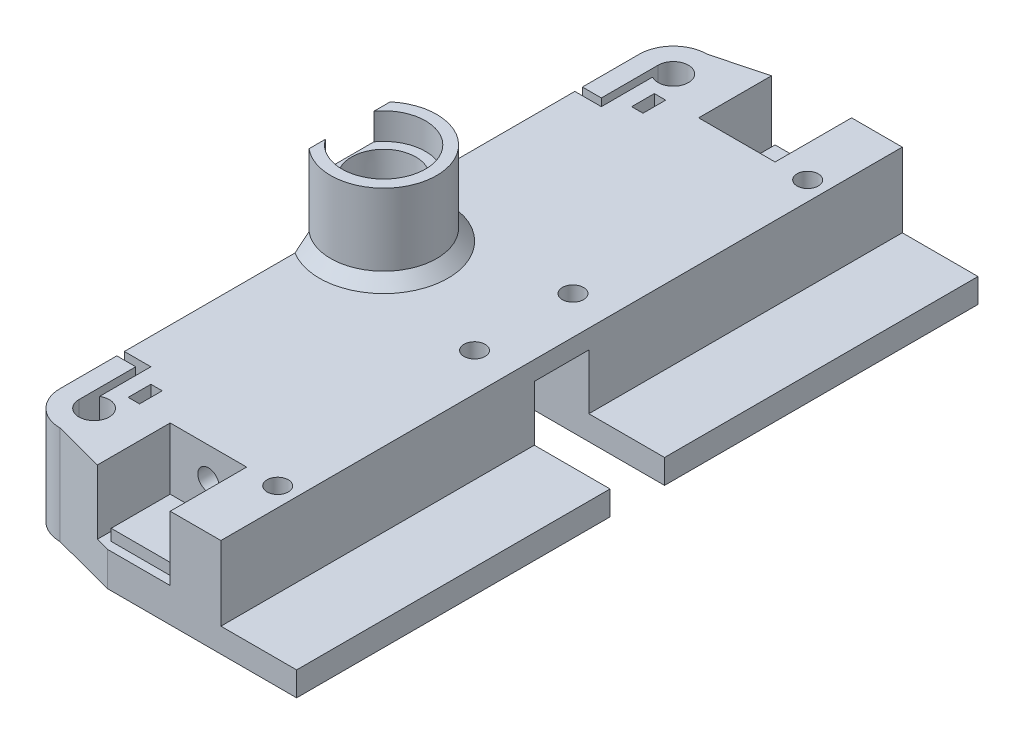
from build123d import *

# Parameters (mm, degrees)
DODANIE_WYCI_GNI_CIE1_DEPTH = 180
SZKIC2_R                    = 4
DODANIE_WYCI_GNI_CIE2_DEPTH = 26
WYTNIJ_WYCI_GNI_CIE1_DEPTH  = 26
SZKIC4_R                    = 1.75
WYTNIJ_WYCI_GNI_CIE2_DEPTH  = 11
WYTNIJ_WYCI_GNI_CIE3_START  = -11
WYTNIJ_WYCI_GNI_CIE3_DEPTH  = 3
DODANIE_WYCI_GNI_CIE3_START = -2
DODANIE_WYCI_GNI_CIE3_DEPTH = 2
WYTNIJ_WYCI_GNI_CIE5_DEPTH  = 21
SZKIC8_W                    = 13
SZKIC8_H                    = 9
SZKIC8_R                    = 2
WYTNIJ_WYCI_GNI_CIE6_DEPTH  = 4
DODANIE_WYCI_GNI_CIE4_START = 22
SZKIC9_R                    = 14
SZKIC9_R_2                  = 4
DODANIE_WYCI_GNI_CIE4_DEPTH = 22
SZKIC10_R                   = 11.05
SZKIC10_R_2                 = 4
WYTNIJ_WYCI_GNI_CIE7_DEPTH  = 7
SZKIC11_R                   = 8
SZKIC11_R_2                 = 4
WYTNIJ_WYCI_GNI_CIE8_DEPTH  = 15
SFAZOWANIE1_SIZE            = 0.5
SFAZOWANIE1_SIZE2           = 12
WYTNIJ_WYCI_GNI_CIE9_START  = 22
WYTNIJ_WYCI_GNI_CIE9_DEPTH  = 22
WYTNIJ_WYCI_GNI_CIE10_START = -3
SZKIC13_R                   = 4
WYTNIJ_WYCI_GNI_CIE10_DEPTH = 3
SZKIC14_R                   = 2
WYTNIJ_WYCI_GNI_CIE11_DEPTH = 8
SZKIC15_R                   = 2.8
WYTNIJ_WYCI_GNI_CIE12_DEPTH = 10
SFAZOWANIE2_SIZE            = 3
SZKIC16_W                   = 20.2
SZKIC16_H                   = 20.2
WYTNIJ_WYCI_GNI_CIE13_DEPTH = 17
SZKIC17_W                   = 15.6
SZKIC17_H                   = 15.6
DODANIE_WYCI_GNI_CIE5_DEPTH = 3
SZKIC18_R                   = 2.8
WYTNIJ_WYCI_GNI_CIE14_DEPTH = 10
SZKIC19_W                   = 20
SZKIC19_H                   = 82.8
DODANIE_WYCI_GNI_CIE6_DEPTH = 0.4


with BuildPart() as part:
    # Szkic1 → Dodanie-wyciągnięcie1 (new body)
    with BuildSketch(Plane.XY):
        Polygon((10, -16), (10, -10), (-10, -10), (-10, 10), (-40, 10), (-40, -16), align=None)
    extrude(amount=DODANIE_WYCI_GNI_CIE1_DEPTH)

    # Szkic2 → Dodanie-wyciągnięcie2 (add)
    with BuildSketch(Plane(origin=(0, 10, 0), x_dir=(1, 0, 0), z_dir=(0, 1, 0))):
        with BuildLine():
            Line((-40, -180), (-40, 0))
            Line((-40, 0), (-57, -4.5))
            ThreePointArc((-57, -4.5), (-63.363961031, -7.136038969), (-66, -13.5))
            Line((-66, -13.5), (-66, -166.5))
            ThreePointArc((-66, -166.5), (-63.363961031, -172.863961031), (-57, -175.5))
            Line((-57, -175.5), (-40, -180))
        make_face()
        with Locations((-57, -90)):
            Circle(SZKIC2_R, mode=Mode.SUBTRACT)
        with Locations((-57, -166.5)):
            Circle(SZKIC2_R, mode=Mode.SUBTRACT)
        with Locations((-57, -13.5)):
            Circle(SZKIC2_R, mode=Mode.SUBTRACT)
    extrude(amount=-DODANIE_WYCI_GNI_CIE2_DEPTH)

    # Szkic3 → Wytnij-wyciągnięcie1 (cut)
    with BuildSketch(Plane(origin=(0, 10, 0), x_dir=(1, 0, 0), z_dir=(0, 1, 0))):
        with BuildLine():
            ThreePointArc((-59, -16.964101615), (-60.464101615, -15.5), (-61, -13.5))
            Line((-61, -13.5), (-61, -28.5))
            Line((-61, -28.5), (-66, -28.5))
            Line((-66, -28.5), (-66, -30.5))
            Line((-66, -30.5), (-59, -30.5))
            Line((-59, -30.5), (-59, -16.964101615))
        make_face()
    wytnij_wyci_gni_cie1 = extrude(amount=-WYTNIJ_WYCI_GNI_CIE1_DEPTH, mode=Mode.SUBTRACT)

    # Szkic4 → Wytnij-wyciągnięcie2 (cut)
    with BuildSketch(Plane.ZY.offset(66)):
        with Locations((23.5, 3)):
            Circle(SZKIC4_R)
        with Locations((23.5, -9)):
            Circle(SZKIC4_R)
    wytnij_wyci_gni_cie2 = extrude(amount=-WYTNIJ_WYCI_GNI_CIE2_DEPTH, mode=Mode.SUBTRACT)

    # Szkic5 → Wytnij-wyciągnięcie3 (cut)
    with BuildSketch(Plane.ZY.offset(66).offset(WYTNIJ_WYCI_GNI_CIE3_START)):
        Polygon((20.5, 10), (20.5, 1.267949192), (23.5, -0.464101615), (26.5, 1.267949192), (26.5, 10), align=None)
        Polygon((26.5, -7.267949192), (23.5, -5.535898385), (20.5, -7.267949192), (20.5, -16), (26.5, -16), align=None)
    wytnij_wyci_gni_cie3 = extrude(amount=-WYTNIJ_WYCI_GNI_CIE3_DEPTH, mode=Mode.SUBTRACT)

    # Szkic6 → Dodanie-wyciągnięcie3 (add)
    with BuildSketch(Plane.XZ.offset(16).offset(DODANIE_WYCI_GNI_CIE3_START)):
        with BuildLine():
            Line((-57, 17.5), (-57, 9.5))
            ThreePointArc((-57, 9.5), (-53, 13.5), (-57, 17.5))
        make_face()
    dodanie_wyci_gni_cie3 = extrude(amount=DODANIE_WYCI_GNI_CIE3_DEPTH)

    # Lustro1: Wytnij-wyciągnięcie1, Wytnij-wyciągnięcie2, Wytnij-wyciągnięcie3, Dodanie-wyciągnięcie3 across plane
    add(wytnij_wyci_gni_cie1.mirror(Plane.XY.offset(90)), mode=Mode.SUBTRACT)
    add(wytnij_wyci_gni_cie2.mirror(Plane.XY.offset(90)), mode=Mode.SUBTRACT)
    add(wytnij_wyci_gni_cie3.mirror(Plane.XY.offset(90)), mode=Mode.SUBTRACT)
    add(dodanie_wyci_gni_cie3.mirror(Plane.XY.offset(90)))

    # Szkic7 → Wytnij-wyciągnięcie5 (cut)
    with BuildSketch(Plane.XZ.offset(16)):
        with BuildLine():
            ThreePointArc((-60, 97.2), (-62.121320344, 96.321320344), (-63, 94.2))
            Line((-63, 94.2), (-63, 85.8))
            ThreePointArc((-63, 85.8), (-62.121320344, 83.678679656), (-60, 82.8))
            Line((-60, 82.8), (-55.2, 82.8))
            ThreePointArc((-55.2, 82.8), (-51.7, 79.3), (-48.2, 82.8))
            Line((-48.2, 82.8), (11.571529958, 82.8))
            Line((11.571529958, 82.8), (11.571529958, 97.2))
            Line((11.571529958, 97.2), (-48.2, 97.2))
            ThreePointArc((-48.2, 97.2), (-51.7, 100.7), (-55.2, 97.2))
            Line((-55.2, 97.2), (-60, 97.2))
        make_face()
    extrude(amount=-WYTNIJ_WYCI_GNI_CIE5_DEPTH, mode=Mode.SUBTRACT)

    # Szkic8 → Wytnij-wyciągnięcie6 (cut)
    with BuildSketch(Plane.XZ.offset(-5)):
        with Locations((-41.7, 90)):
            Rectangle(SZKIC8_W, SZKIC8_H)
        with Locations((-51.7, 97.2)):
            Circle(SZKIC8_R)
        with Locations((-51.7, 82.8)):
            Circle(SZKIC8_R)
    extrude(amount=-WYTNIJ_WYCI_GNI_CIE6_DEPTH, mode=Mode.SUBTRACT)

    # Szkic9 → Dodanie-wyciągnięcie4 (add)
    with BuildSketch(Plane(origin=(0, 10, 0), x_dir=(1, 0, 0), z_dir=(0, 1, 0)).offset(DODANIE_WYCI_GNI_CIE4_START)):
        with Locations((-57, -90)):
            Circle(SZKIC9_R)
        with Locations((-57, -90)):
            Circle(SZKIC9_R_2, mode=Mode.SUBTRACT)
    extrude(amount=-DODANIE_WYCI_GNI_CIE4_DEPTH)

    # Szkic10 → Wytnij-wyciągnięcie7 (cut)
    with BuildSketch(Plane(origin=(0, 32, 0), x_dir=(1, 0, 0), z_dir=(0, 1, 0))):
        with Locations((-57, -90)):
            Circle(SZKIC10_R)
        with Locations((-57, -90)):
            Circle(SZKIC10_R_2, mode=Mode.SUBTRACT)
    extrude(amount=-WYTNIJ_WYCI_GNI_CIE7_DEPTH, mode=Mode.SUBTRACT)

    # Szkic11 → Wytnij-wyciągnięcie8 (cut)
    with BuildSketch(Plane(origin=(0, 25, 0), x_dir=(1, 0, 0), z_dir=(0, 1, 0))):
        with Locations((-57, -90)):
            Circle(SZKIC11_R)
        with Locations((-57, -90)):
            Circle(SZKIC11_R_2, mode=Mode.SUBTRACT)
    extrude(amount=-WYTNIJ_WYCI_GNI_CIE8_DEPTH, mode=Mode.SUBTRACT)

    # Sfazowanie1
    sfazowanie1_edges = [part.edges().sort_by_distance(p)[0] for p in [
        (-65, 25, 90),
    ]]
    sfazowanie1_side = [part.faces().sort_by_distance(p)[0] for p in [
        (-67.737458803, 25, 90),
    ]]
    chamfer(sfazowanie1_edges, length=SFAZOWANIE1_SIZE, length2=SFAZOWANIE1_SIZE2, reference=sfazowanie1_side[0])

    # Szkic12 → Wytnij-wyciągnięcie9 (cut)
    with BuildSketch(Plane(origin=(0, 10, 0), x_dir=(1, 0, 0), z_dir=(0, 1, 0)).offset(WYTNIJ_WYCI_GNI_CIE9_START)):
        with BuildLine():
            Line((-66, -100.723805295), (-66, -79.276194705))
            ThreePointArc((-66, -79.276194705), (-71, -90), (-66, -100.723805295))
        make_face()
    extrude(amount=-WYTNIJ_WYCI_GNI_CIE9_DEPTH, mode=Mode.SUBTRACT)

    # Szkic13 → Wytnij-wyciągnięcie10 (cut)
    with BuildSketch(Plane.XZ.offset(16).offset(WYTNIJ_WYCI_GNI_CIE10_START)):
        with BuildLine():
            Line((-60, 104.2), (-30, 104.2))
            ThreePointArc((-30, 104.2), (-26.464466094, 102.735533906), (-25, 99.2))
            Line((-25, 99.2), (-25, 80.8))
            ThreePointArc((-25, 80.8), (-26.464466094, 77.264466094), (-30, 75.8))
            Line((-30, 75.8), (-60, 75.8))
            ThreePointArc((-60, 75.8), (-63.535533906, 77.264466094), (-65, 80.8))
            Line((-65, 80.8), (-65, 99.2))
            ThreePointArc((-65, 99.2), (-63.535533906, 102.735533906), (-60, 104.2))
        make_face()
        with Locations((-57, 90)):
            Circle(SZKIC13_R, mode=Mode.SUBTRACT)
    extrude(amount=WYTNIJ_WYCI_GNI_CIE10_DEPTH, mode=Mode.SUBTRACT)

    # Szkic14 → Wytnij-wyciągnięcie11 (cut)
    with BuildSketch(Plane.XZ.offset(13)):
        with Locations((-60, 101.2)):
            Circle(SZKIC14_R)
        with Locations((-30, 101.2)):
            Circle(SZKIC14_R)
        with Locations((-30, 78.8)):
            Circle(SZKIC14_R)
        with Locations((-60, 78.8)):
            Circle(SZKIC14_R)
    extrude(amount=-WYTNIJ_WYCI_GNI_CIE11_DEPTH, mode=Mode.SUBTRACT)

    # Szkic15 → Wytnij-wyciągnięcie12 (cut)
    with BuildSketch(Plane(origin=(0, 10, 0), x_dir=(1, 0, 0), z_dir=(0, 1, 0))):
        with Locations((-15, -160)):
            Circle(SZKIC15_R)
        with Locations((-20, -103)):
            Circle(SZKIC15_R)
        with Locations((-15, -20)):
            Circle(SZKIC15_R)
        with Locations((-20, -77)):
            Circle(SZKIC15_R)
    extrude(amount=-WYTNIJ_WYCI_GNI_CIE12_DEPTH, mode=Mode.SUBTRACT)

    # Sfazowanie2
    sfazowanie2_edges = [part.edges().sort_by_distance(p)[0] for p in [
        (-43, 10, 90),
    ]]
    chamfer(sfazowanie2_edges, length=SFAZOWANIE2_SIZE)

    # Szkic16 → Wytnij-wyciągnięcie13 (cut)
    with BuildSketch(Plane(origin=(0, 10, 0), x_dir=(1, 0, 0), z_dir=(0, 1, 0))):
        with Locations((-33.5, -169.9)):
            Rectangle(SZKIC16_W, SZKIC16_H)
    wytnij_wyci_gni_cie13 = extrude(amount=-WYTNIJ_WYCI_GNI_CIE13_DEPTH, mode=Mode.SUBTRACT)

    # Szkic17 → Dodanie-wyciągnięcie5 (add)
    with BuildSketch(Plane(origin=(0, -7, 0), x_dir=(1, 0, 0), z_dir=(0, 1, 0))):
        with Locations((-33.5, -169.9)):
            Rectangle(SZKIC17_W, SZKIC17_H)
    dodanie_wyci_gni_cie5 = extrude(amount=DODANIE_WYCI_GNI_CIE5_DEPTH)

    # Szkic18 → Wytnij-wyciągnięcie14 (cut)
    with BuildSketch(Plane.XY.offset(159.8)):
        with Locations((-33.5, 2)):
            Circle(SZKIC18_R)
    wytnij_wyci_gni_cie14 = extrude(amount=-WYTNIJ_WYCI_GNI_CIE14_DEPTH, mode=Mode.SUBTRACT)

    # Lustro2: Wytnij-wyciągnięcie13, Dodanie-wyciągnięcie5, Wytnij-wyciągnięcie14 across plane
    add(wytnij_wyci_gni_cie13.mirror(Plane.XY.offset(90)), mode=Mode.SUBTRACT)
    add(dodanie_wyci_gni_cie5.mirror(Plane.XY.offset(90)))
    add(wytnij_wyci_gni_cie14.mirror(Plane.XY.offset(90)), mode=Mode.SUBTRACT)

    # Szkic19 → Dodanie-wyciągnięcie6 (add)
    with BuildSketch(Plane(origin=(0, -10, 0), x_dir=(1, 0, 0), z_dir=(0, 1, 0))):
        with Locations((0, -41.4)):
            Rectangle(SZKIC19_W, SZKIC19_H)
        with Locations((0, -138.6)):
            Rectangle(SZKIC19_W, SZKIC19_H)
    extrude(amount=DODANIE_WYCI_GNI_CIE6_DEPTH)


solid = part.part
